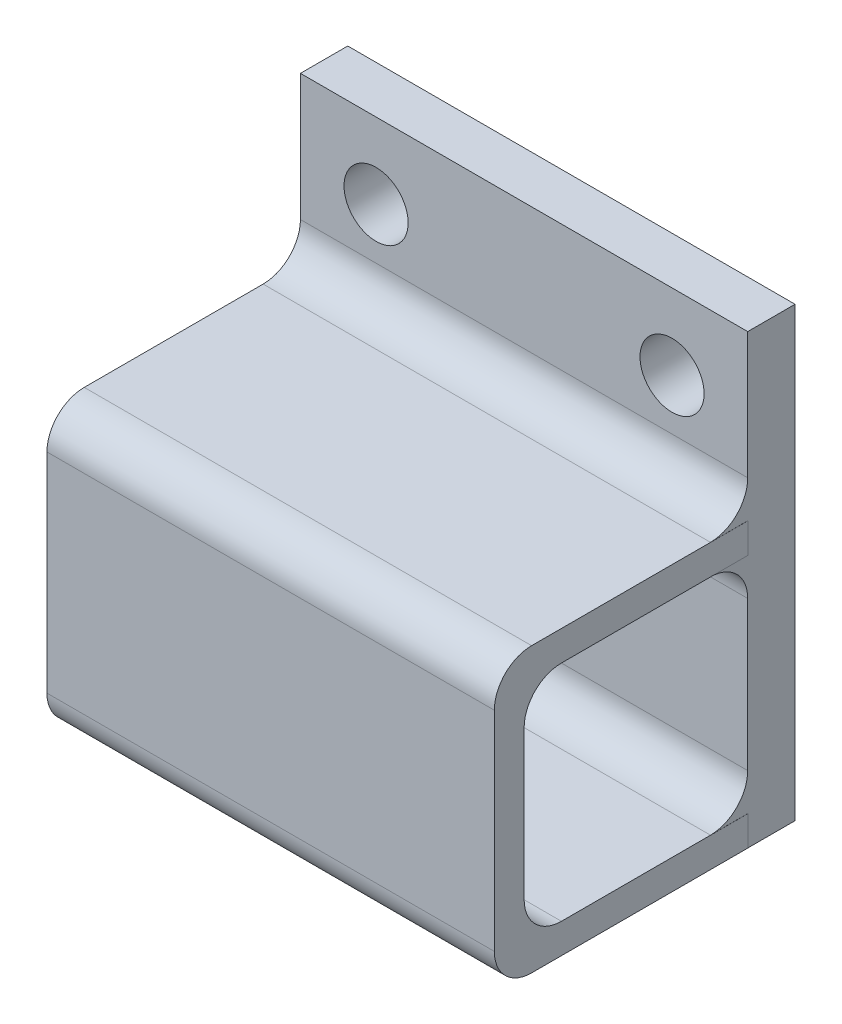
from build123d import *

# Parameters (mm, degrees)
SKETCH1_W           = 30
SKETCH1_H           = 30
SKETCH1_R           = 2.15
BOSS_EXTRUDE1_DEPTH = 3.175
SKETCH2_W           = 30.005666414
SKETCH2_H           = 19.009049167
SKETCH2_W_2         = 23.655666414
SKETCH2_H_2         = 12.659049167
BOSS_EXTRUDE2_DEPTH = 15
SKETCH3_W           = 30.005666414
SKETCH3_H           = 19.009049167
BOSS_EXTRUDE3_DEPTH = 2
SKETCH4_W           = 15
SKETCH4_H           = 15
CUT_EXTRUDE1_DEPTH  = 40.145506025
FILLET1_R           = 2.5


with BuildPart() as part:
    # Sketch1 → Boss-Extrude1 (new body)
    with BuildSketch(Plane.XY):
        Rectangle(SKETCH1_W, SKETCH1_H)
        with Locations((-9.924911661, 9.924911661)):
            Circle(SKETCH1_R, mode=Mode.SUBTRACT)
        with Locations((9.924911661, 9.924911661)):
            Circle(SKETCH1_R, mode=Mode.SUBTRACT)
    extrude(amount=BOSS_EXTRUDE1_DEPTH)

    # Sketch2 → Boss-Extrude2 (add)
    with BuildSketch(Plane.XY.offset(3.175)):
        with Locations((0.002833207, -5.495475417)):
            Rectangle(SKETCH2_W, SKETCH2_H)
        with Locations((0.002833207, -5.495475417)):
            Rectangle(SKETCH2_W_2, SKETCH2_H_2, mode=Mode.SUBTRACT)
    extrude(amount=BOSS_EXTRUDE2_DEPTH)

    # Sketch3 → Boss-Extrude3 (add)
    with BuildSketch(Plane.XY.offset(18.175)):
        with Locations((0.002833207, -5.495475417)):
            Rectangle(SKETCH3_W, SKETCH3_H)
    extrude(amount=BOSS_EXTRUDE3_DEPTH)

    # Sketch4 → Cut-Extrude1 (cut, through all)
    with BuildSketch(Plane.ZY.offset(15)):
        with Locations((10.675, -5.5)):
            Rectangle(SKETCH4_W, SKETCH4_H)
    extrude(amount=-CUT_EXTRUDE1_DEPTH, mode=Mode.SUBTRACT)

    # Fillet1
    fillet1_edges = [part.edges().sort_by_distance(p)[0] for p in [
        (0, 4.009049167, 3.175),
        (0.002833207, -13, 18.175),
        (0, 2, 3.175),
        (0.002833207, 2, 18.175),
        (0, -13, 3.175),
        (0.002833207, -15, 20.175),
        (0.002833207, 4.009049167, 20.175),
    ]]
    fillet(fillet1_edges, radius=FILLET1_R)


solid = part.part
